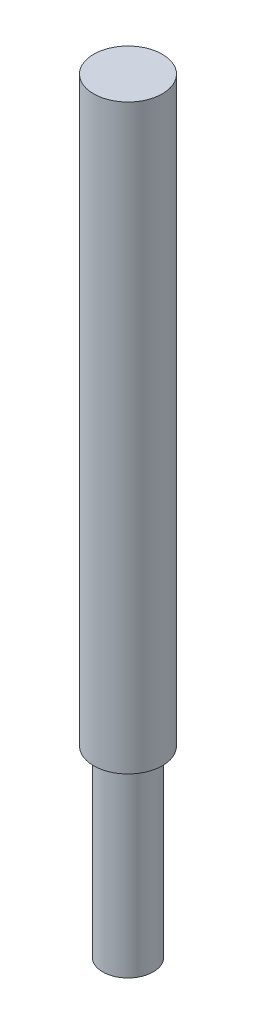
from build123d import *

# Parameters (mm, degrees)
SKETCH1_R           = 2.38125
BOSS_EXTRUDE1_DEPTH = 40.3733
SKETCH2_R           = 1.7526
BOSS_EXTRUDE2_DEPTH = 12.7


with BuildPart() as part:
    # Sketch1 → Boss-Extrude1 (new body)
    with BuildSketch(Plane(origin=(0, 0, 0), x_dir=(1, 0, 0), z_dir=(0, 1, 0))):
        Circle(SKETCH1_R)
    extrude(amount=BOSS_EXTRUDE1_DEPTH)

    # Sketch2 → Boss-Extrude2 (add)
    with BuildSketch(Plane.XZ):
        Circle(SKETCH2_R)
    extrude(amount=BOSS_EXTRUDE2_DEPTH)


solid = part.part
